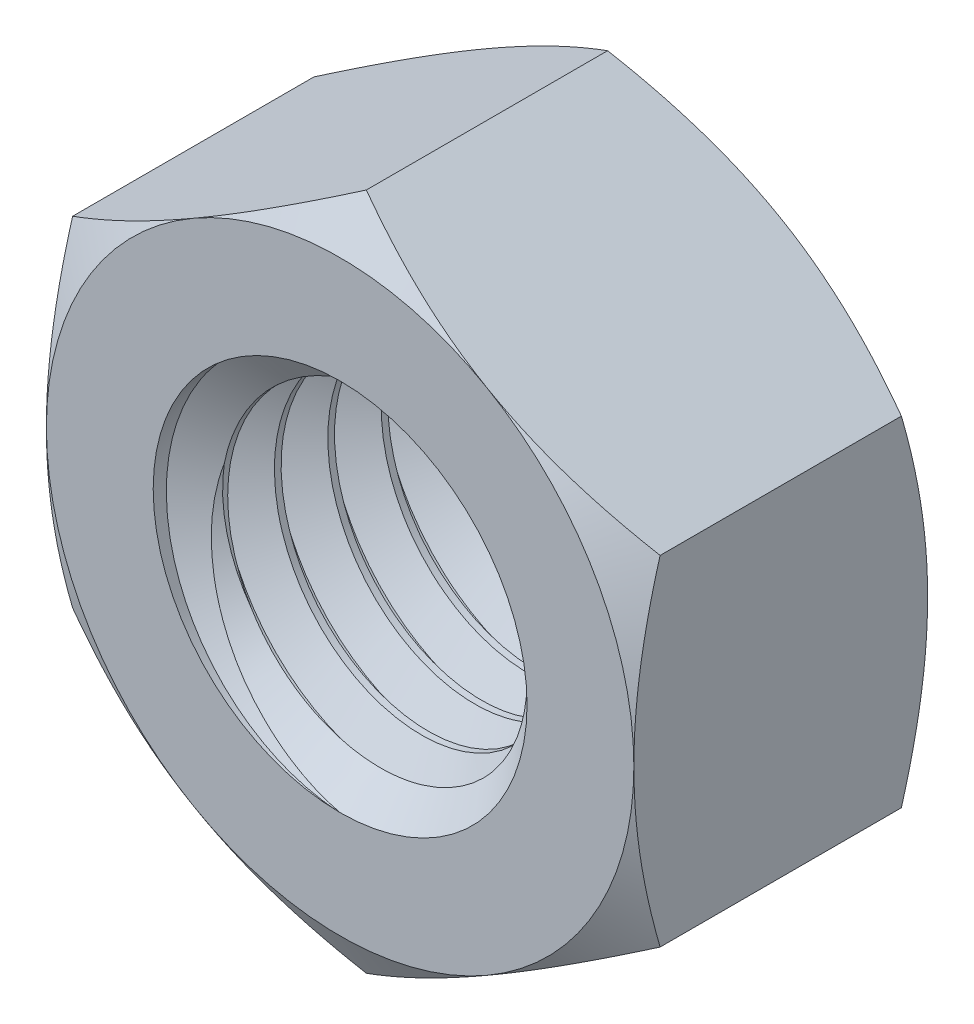
from build123d import *

# Parameters (mm, degrees)
EXTRUDE1_DEPTH          = 5.5
SKETCH13_R              = 7
BOSS_EXTRUDE1_DEPTH     = 11
CUT_SWEEP1_PITCH        = 2
SKETCH7_OUTSIDE_W       = 119.06
SKETCH7_OUTSIDE_H       = 122.464
SKETCH7_OUTSIDE_R       = 11
EXTRUDE2_DEPTH          = 25.4
EXTRUDE2_DRAFT          = -60
MIRROR2_COPY_1_SKETCH_W = 119.06
MIRROR2_COPY_1_SKETCH_H = 122.464
MIRROR2_COPY_1_SKETCH_R = 11
MIRROR2_COPY_1_DEPTH    = 25.4
MIRROR2_COPY_1_DRAFT    = -60


with BuildPart() as part:
    # Sketch1 → Extrude1 (new, symmetric)
    with BuildSketch(Plane.XY):
        Polygon((-11, 6.350852961), (-11, -6.350852961), (0, -12.701705922), (11, -6.350852961), (11, 6.350852961), (0, 12.701705922), align=None)
    extrude(amount=EXTRUDE1_DEPTH, both=True)

    # Cut-Extrude2 cone 1 section (through the dimple's axis) → Cut-Extrude2 (revolve, cut)
    with BuildSketch(Plane(origin=(0, 0, 5.5), x_dir=(0, -1, 0), z_dir=(1, 0, 0))):
        Polygon((0, 0), (7, 0), (0, 7), align=None)
    revolve(axis=Axis((0, 0, 5.5), (0, 0, -1)), mode=Mode.SUBTRACT)

    # Cut-Extrude3 cone 1 section (through the dimple's axis) → Cut-Extrude3 (revolve, cut)
    with BuildSketch(Plane(origin=(0, 0, -5.5), x_dir=(0, 1, 0), z_dir=(1, 0, 0))):
        Polygon((0, 0), (7, 0), (0, 7), align=None)
    revolve(axis=Axis((0, 0, -5.5), (0, 0, 1)), mode=Mode.SUBTRACT)


with BuildPart() as body_2:
    # Sketch13 → Boss-Extrude1 (new body)
    with BuildSketch(Plane(origin=(0, 0, -5.5), x_dir=(-1, 0, 0), z_dir=(0, 0, -1))):
        Circle(SKETCH13_R)
    extrude(amount=-BOSS_EXTRUDE1_DEPTH)

    # Cut-Sweep1: arcs per turn and ends read off the stored shape
    # Cut-Sweep1: the profile of Sketch12 profile screwed along a right-hand helix through 7 turns, 10 arcs to a turn; built about Z, then put on its axis
    cut_sweep1_z = Axis((0, 0, 0), (0, 0, 1))
    cut_sweep1_corners = [(7.0003, 0, -3.750173205), (7.0003, 0, -1.999826795), (5.700961894, 0, -2.75), (5.700961894, 0, -3)]
    with BuildLine(mode=Mode.PRIVATE) as cut_sweep1_profile:
        Line(cut_sweep1_corners[0], cut_sweep1_corners[1])
        Line(cut_sweep1_corners[1], cut_sweep1_corners[2])
        Line(cut_sweep1_corners[2], cut_sweep1_corners[3])
        Line(cut_sweep1_corners[3], cut_sweep1_corners[0])
    cut_sweep1_cap = Face(cut_sweep1_profile.wire())
    cut_sweep1_turn_angles = [0, 18, 36, 54, 72, 90, 108, 126, 144, 162, 180, 198, 216, 234, 252, 270, 288, 306, 324, 342, 360]
    cut_sweep1_turn_weights = [1, 0.9510565162951535, 1, 0.9510565162951535, 1, 0.9510565162951535, 1, 0.9510565162951535, 1, 0.9510565162951535, 1, 0.9510565162951535, 1, 0.9510565162951535, 1, 0.9510565162951535, 1, 0.9510565162951535, 1, 0.9510565162951535, 1]
    cut_sweep1_turn_rails = [Edge.make_bspline([Vector(p[0], p[1], 0).rotate(cut_sweep1_z, cut_sweep1_turn_angles[k]) / cut_sweep1_turn_weights[k] + Vector(0, 0, p[2] + CUT_SWEEP1_PITCH * cut_sweep1_turn_angles[k] / 360) for k in range(21)], [0, 0, 0, 1, 1, 2, 2, 3, 3, 4, 4, 5, 5, 6, 6, 7, 7, 8, 8, 9, 9, 10, 10, 10], 2, cut_sweep1_turn_weights) for p in cut_sweep1_corners]
    cut_sweep1_turn_sides = [Face.make_surface_from_curves(cut_sweep1_turn_rails[p[0]], cut_sweep1_turn_rails[p[1]]) for p in [(0, 1), (1, 2), (2, 3), (3, 0)]]
    cut_sweep1 = Plane(origin=(0, 0, -5.5), x_dir=(0, 1, 0), z_dir=(0, 0, 1)) * Solid(Shell([*[p.moved(Location((0, 0, CUT_SWEEP1_PITCH * i))) for i in range(7) for p in cut_sweep1_turn_sides], cut_sweep1_cap, cut_sweep1_cap.rotate(cut_sweep1_z, 2520).moved(Location((0, 0, CUT_SWEEP1_PITCH * 2520 / 360)))]))
    add(cut_sweep1, mode=Mode.SUBTRACT)


with BuildPart() as part_1:
    add(part.part)

    # Combine1: cut body 2
    add(body_2.part, mode=Mode.SUBTRACT)


with BuildPart() as extrude2_tool:
    # Sketch7 outside → Extrude2 (with draft: the straight prism first)
    with BuildSketch(Plane.XY.offset(5.5)):
        Rectangle(SKETCH7_OUTSIDE_W, SKETCH7_OUTSIDE_H)
        Circle(SKETCH7_OUTSIDE_R, mode=Mode.SUBTRACT)
    extrude(amount=-EXTRUDE2_DEPTH)
    # Extrude2: the draft: its side faces are tilted about the plane it starts from
    extrude2_sides = [extrude2_tool.faces().sort_by_distance(p)[0] for p in [
        (0, -61.232, -7.2),
        (59.53, 0, -7.2),
        (0, 61.232, -7.2),
        (-59.53, 0, -7.2),
        (-11, 0, -7.2),
    ]]
    draft(extrude2_sides, Plane.XY.offset(5.5), EXTRUDE2_DRAFT)


with BuildPart() as part_2:
    add(part_1.part)

    # Extrude2: cut by extrude2_tool
    add(extrude2_tool.part, mode=Mode.SUBTRACT)


with BuildPart() as mirror2_copy_1_tool:
    # Mirror2 copy 1 sketch → Mirror2 copy 1 (with draft: the straight prism first)
    with BuildSketch(Plane(origin=(0, 0, -5.5), x_dir=(1, 0, 0), z_dir=(0, 0, -1))):
        Rectangle(MIRROR2_COPY_1_SKETCH_W, MIRROR2_COPY_1_SKETCH_H)
        Circle(MIRROR2_COPY_1_SKETCH_R, mode=Mode.SUBTRACT)
    extrude(amount=-MIRROR2_COPY_1_DEPTH)
    # Mirror2 copy 1: the draft: its side faces are tilted about the plane it starts from
    mirror2_copy_1_sides = [mirror2_copy_1_tool.faces().sort_by_distance(p)[0] for p in [
        (0, -61.232, 7.2),
        (59.53, 0, 7.2),
        (0, 61.232, 7.2),
        (-59.53, 0, 7.2),
        (-11, 0, 7.2),
    ]]
    draft(mirror2_copy_1_sides, Plane(origin=(0, 0, -5.5), x_dir=(1, 0, 0), z_dir=(0, 0, -1)), MIRROR2_COPY_1_DRAFT)


with BuildPart() as part_3:
    add(part_2.part)

    # Mirror2 copy 1: cut by mirror2_copy_1_tool
    add(mirror2_copy_1_tool.part, mode=Mode.SUBTRACT)


solid = part_3.part
